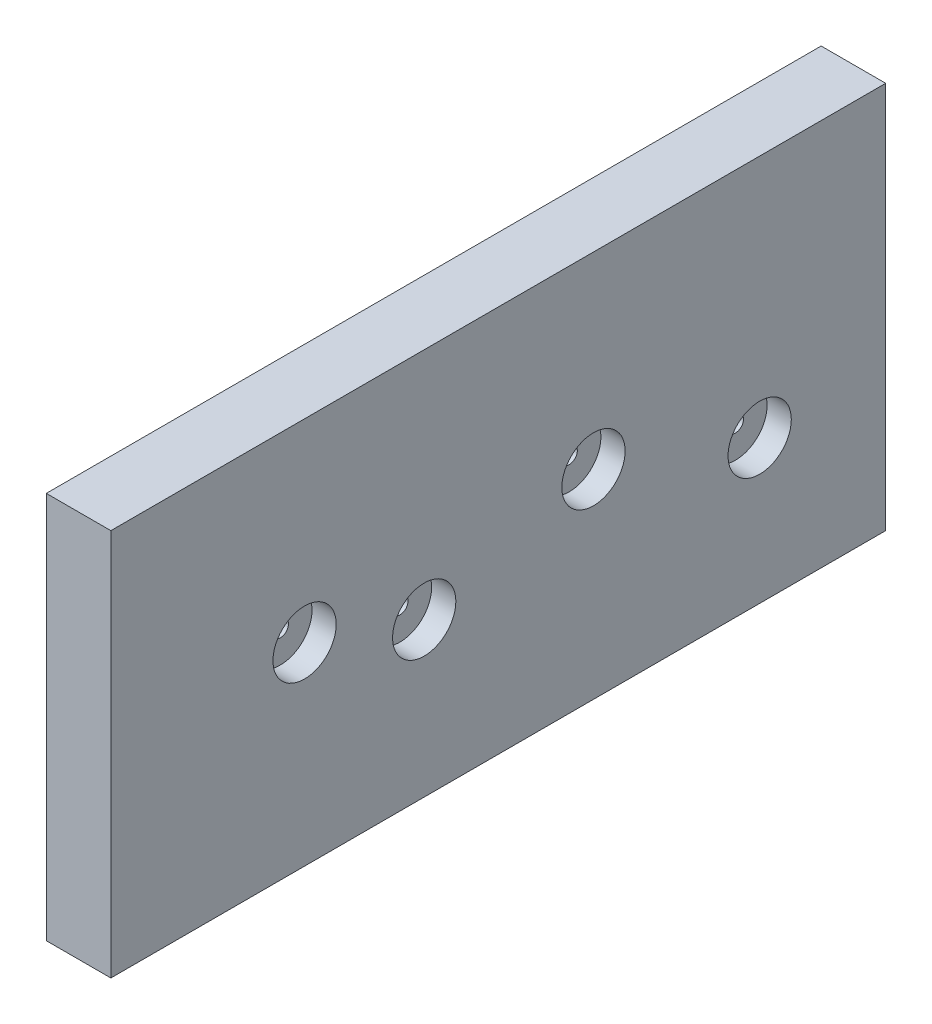
from build123d import *

# Parameters (mm, degrees)
SKETCH1_W                       = 152.4
SKETCH1_H                       = 76.2
SKETCH1_R                       = 1.5875
BOSS_EXTRUDE1_DEPTH             = 12.7
SKETCH2_R                       = 6.223
CUT_EXTRUDE1_DEPTH              = 4.7625
F_1_4_0_25_DIAMETER_HOLE1_D     = 6.35
F_1_4_0_25_DIAMETER_HOLE1_DEPTH = 38.1
F_1_4_0_25_DIAMETER_HOLE1_TIP   = 1.907732465


with BuildPart() as part:
    # Sketch1 → Boss-Extrude1 (new body)
    with BuildSketch(Plane(origin=(0, 0, 0), x_dir=(0, 0, -1), z_dir=(1, 0, 0))):
        Rectangle(SKETCH1_W, SKETCH1_H)
        with Locations((18.72253158, 1.096077429)):
            Circle(SKETCH1_R, mode=Mode.SUBTRACT)
        with Locations((-38.1, 0)):
            Circle(SKETCH1_R, mode=Mode.SUBTRACT)
        with Locations((-14.571224015, -7.860160654)):
            Circle(SKETCH1_R, mode=Mode.SUBTRACT)
        with Locations((51.408255992, -9.873506971)):
            Circle(SKETCH1_R, mode=Mode.SUBTRACT)
    extrude(amount=BOSS_EXTRUDE1_DEPTH)

    # Sketch2 → Cut-Extrude1 (cut)
    with BuildSketch(Plane.ZY.offset(-12.7)):
        with Locations((38.1, 0)):
            Circle(SKETCH2_R)
        with Locations((14.571224015, -7.860160654)):
            Circle(SKETCH2_R)
        with Locations((-18.72253158, 1.096077429)):
            Circle(SKETCH2_R)
        with Locations((-51.408255992, -9.873506971)):
            Circle(SKETCH2_R)
    extrude(amount=CUT_EXTRUDE1_DEPTH, mode=Mode.SUBTRACT)

    # 1/4 (0.25) Diameter Hole1
    with Locations(Plane.XZ.offset(38.1)):
        with Locations((6.35, -63.5), (6.35, 0), (6.35, 57.15)):
            Hole(F_1_4_0_25_DIAMETER_HOLE1_D / 2, depth=F_1_4_0_25_DIAMETER_HOLE1_DEPTH)
            with Locations((0, 0, -(F_1_4_0_25_DIAMETER_HOLE1_DEPTH + F_1_4_0_25_DIAMETER_HOLE1_TIP / 2))):  # 118° drill point
                Cone(0, F_1_4_0_25_DIAMETER_HOLE1_D / 2, F_1_4_0_25_DIAMETER_HOLE1_TIP, mode=Mode.SUBTRACT)


solid = part.part
